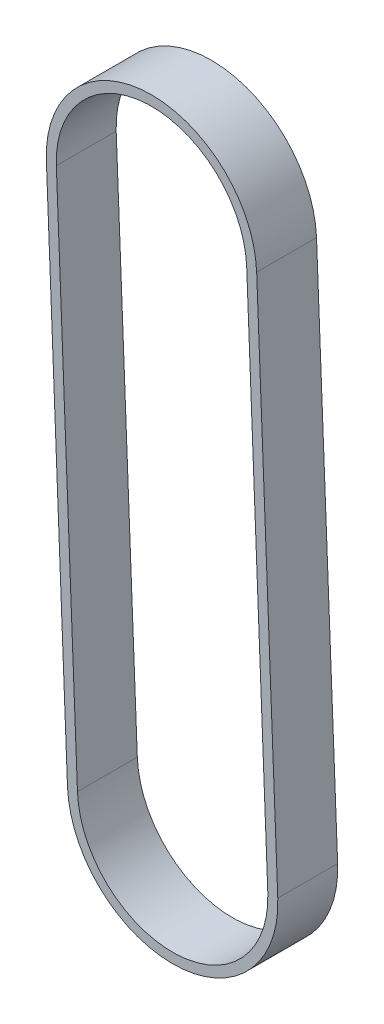
from build123d import *

# Parameters (mm, degrees)
EXTRUDE_THIN1_DEPTH = 9


with BuildPart() as part:
    # Sketch2 → Extrude-Thin1 (new body)
    with BuildSketch(Plane.XY):
        with BuildLine():
            Line((-12.655217511, -80.538068973), (-15.830217511, -0.601099214))
            ThreePointArc((-15.830217511, -0.601099214), (-0.646752496, 15.83839145), (15.792738168, 0.654926435))
            Line((15.792738168, 0.654926435), (18.967738168, -79.282043325))
            ThreePointArc((18.967738168, -79.282043325), (3.784273153, -95.721533988), (-12.655217511, -80.538068973))
        make_face()
        with BuildLine():
            Line((-11.1563993, -80.478537722), (-14.3313993, -0.541567963))
            ThreePointArc((-14.3313993, -0.541567963), (-0.587221245, 14.339573238), (14.293919956, 0.595395184))
            Line((14.293919956, 0.595395184), (17.468919956, -79.341574576))
            ThreePointArc((17.468919956, -79.341574576), (3.724741902, -94.222715777), (-11.1563993, -80.478537722))
        make_face(mode=Mode.SUBTRACT)
    extrude(amount=-EXTRUDE_THIN1_DEPTH)


solid = part.part
